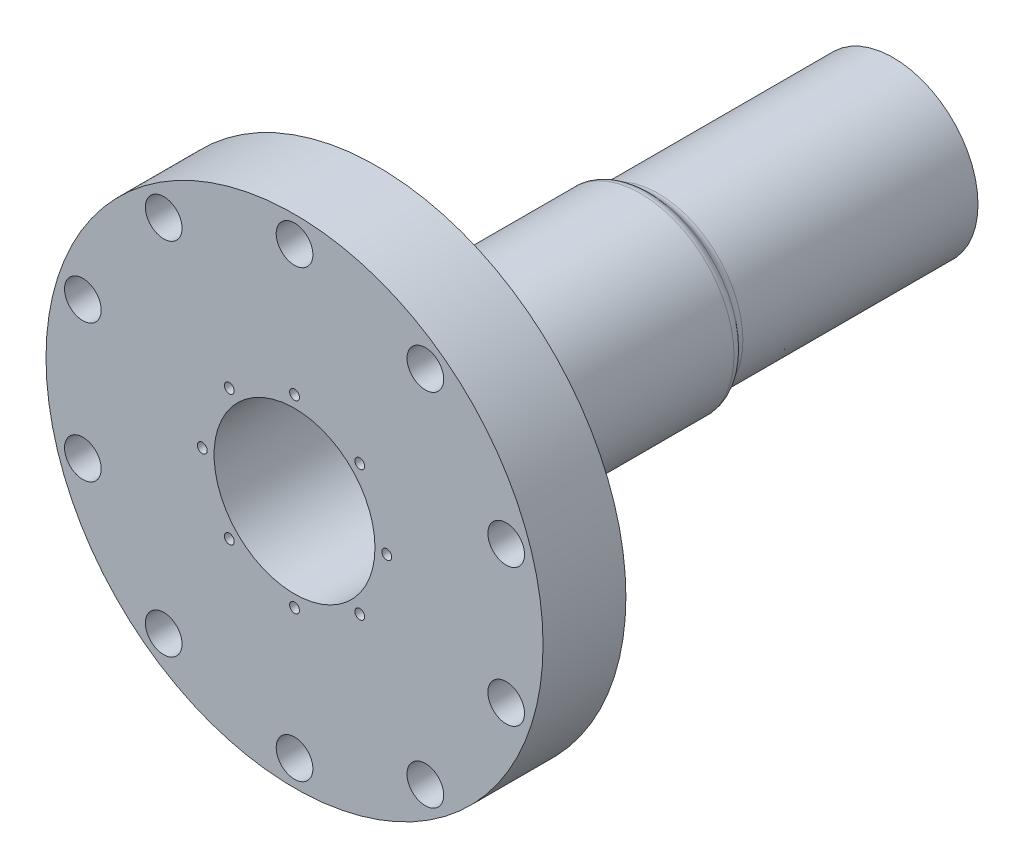
from build123d import *

# Parameters (mm, degrees)
SKETCH1_R                 = 19.5
SKETCH1_R_2               = 18.5
EXTRUDE1_DEPTH            = 137.668
SKETCH4_R                 = 57.15
SKETCH4_R_2               = 19.5
EXTRUDE2_DEPTH            = 19.05
CUT_EXTRUDE1_REACH        = 161.639
SKETCH5_R                 = 4.2164
CIRPATTERN1_COUNT         = 10
F_4_40_TAPPED_HOLE2_D     = 2.2606
F_4_40_TAPPED_HOLE2_DEPTH = 7.62
F_4_40_TAPPED_HOLE2_TIP   = 0.679152758
SKETCH10_R                = 19
EXTRUDE3_DEPTH            = 25.4
EXTRUDE4_START            = 63
SKETCH12_R                = 21.5
SKETCH12_R_2              = 19
EXTRUDE4_DEPTH            = 63
FILLET1_R                 = 2.54
FILLET2_R                 = 2.54


with BuildPart() as part:
    # Sketch1 → Extrude1 (new body)
    with BuildSketch(Plane.XY):
        Circle(SKETCH1_R)
        Circle(SKETCH1_R_2, mode=Mode.SUBTRACT)
    extrude(amount=-EXTRUDE1_DEPTH)

    # Sketch4 → Extrude2 (add)
    with BuildSketch(Plane.XY):
        Circle(SKETCH4_R)
        Circle(SKETCH4_R_2, mode=Mode.SUBTRACT)
    extrude(amount=-EXTRUDE2_DEPTH)

    # Sketch5 → Cut-Extrude1 (cut, up to next)
    with BuildSketch(Plane.XY, mode=Mode.PRIVATE) as cut_extrude1_sk1:
        with Locations((0, 51.181)):
            Circle(SKETCH5_R)
    cut_extrude1_tool1 = extrude(cut_extrude1_sk1.sketch, amount=-CUT_EXTRUDE1_REACH, mode=Mode.PRIVATE) & part.part
    cut_extrude1 = cut_extrude1_tool1.solids().sort_by_distance((0, 51.181, 0))[0]
    add(cut_extrude1, mode=Mode.SUBTRACT)

    # CirPattern1: Cut-Extrude1 ×10 about axis
    cirpattern1_axis = Axis((0, 0, 0), (0, 0, 1))
    for i in range(1, CIRPATTERN1_COUNT):
        add(cut_extrude1.rotate(cirpattern1_axis, i * 360 / CIRPATTERN1_COUNT), mode=Mode.SUBTRACT)

    # #4-40 Tapped Hole2
    with Locations(Plane.XY):
        with Locations((15, -15), (-15, -15), (-15, 15), (15, 15), (0, 21.213203436), (-21.213203436, 0), (21.213203436, 0), (0, -21.213203436)):
            Hole(F_4_40_TAPPED_HOLE2_D / 2, depth=F_4_40_TAPPED_HOLE2_DEPTH)
            with Locations((0, 0, -(F_4_40_TAPPED_HOLE2_DEPTH + F_4_40_TAPPED_HOLE2_TIP / 2))):  # 118° drill point
                Cone(0, F_4_40_TAPPED_HOLE2_D / 2, F_4_40_TAPPED_HOLE2_TIP, mode=Mode.SUBTRACT)

    # Sketch10 → Extrude3 (cut)
    with BuildSketch(Plane(origin=(0, 0, -137.668), x_dir=(-1, 0, 0), z_dir=(0, 0, -1))):
        Circle(SKETCH10_R)
    extrude(amount=-EXTRUDE3_DEPTH, mode=Mode.SUBTRACT)

    # Sketch12 → Extrude4 (add)
    with BuildSketch(Plane(origin=(0, 0, -19.05), x_dir=(-1, 0, 0), z_dir=(0, 0, -1)).offset(EXTRUDE4_START)):
        with Locations(Location((0, 0, 0), (0, 0, 180))):
            Circle(SKETCH12_R)
        Circle(SKETCH12_R_2, mode=Mode.SUBTRACT)
    extrude(amount=-EXTRUDE4_DEPTH)

    # Fillet1
    # the kernel refuses this fillet: 2.54 mm, written as the material it takes off along each edge
    with BuildSketch(Plane(origin=(0, 0, -82.05), x_dir=(1, 0, 0), z_dir=(0, 1, 0))) as fillet1_piece_1:
        with BuildLine():
            CenterArc((18.96, -2.481934729), FILLET1_R, 0, 77.725329785)
            Line((21.5, -2.481934729), (21.5508, -2.481934729))
            Line((21.5508, -2.481934729), (21.5508, 0))
            Line((21.5508, 0), (21.5, 0.0508))
            ThreePointArc((21.5, 0.0508), (20.5, 0.0508), (19.5108, 0.049638695))
            Line((19.5108, 0.049638695), (19.5, 0))
        make_face()
    revolve(axis=Axis((0, 0, -82.05), (0, 0, -1)), mode=Mode.SUBTRACT)

    # Fillet2
    fillet2_edges = [part.edges().sort_by_distance(p)[0] for p in [
        (-19.5, 0, -82.05),
    ]]
    fillet(fillet2_edges, radius=FILLET2_R)


solid = part.part
